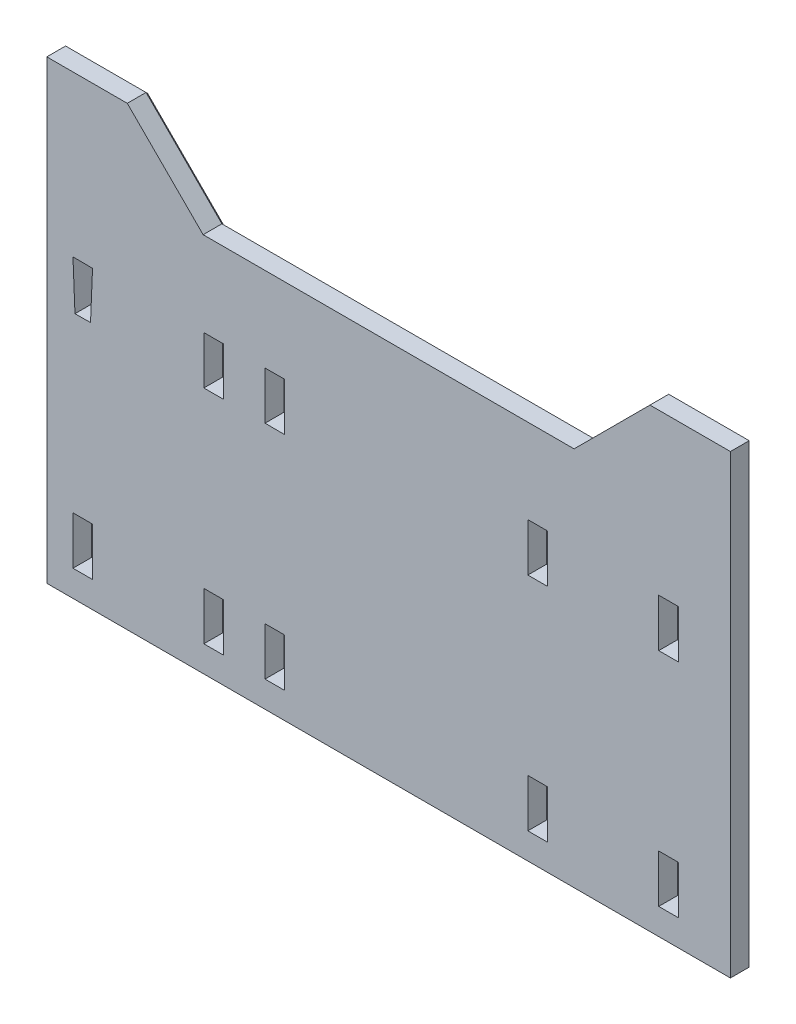
from build123d import *

# Parameters (mm, degrees)
SKETCH1_W           = 127.440194606
SKETCH1_H           = 60
SKETCH1_W_2         = 3.65
SKETCH1_H_2         = 8.949747706
BOSS_EXTRUDE1_DEPTH = 4
BOSS_EXTRUDE2_DEPTH = 4
CHAMFER1_SIZE       = 0.5


with BuildPart() as part:
    # Sketch1 → Boss-Extrude1 (new body)
    with BuildSketch(Plane.XY):
        Rectangle(SKETCH1_W, SKETCH1_H)
        with Locations((-32.620097303, 20.65)):
            Rectangle(SKETCH1_W_2, SKETCH1_H_2, mode=Mode.SUBTRACT)
        with Locations((27.7799027, 20.65)):
            Rectangle(SKETCH1_W_2, SKETCH1_H_2, mode=Mode.SUBTRACT)
        with Locations((27.7799027, -20.65)):
            Rectangle(SKETCH1_W_2, SKETCH1_H_2, mode=Mode.SUBTRACT)
        Polygon((-19.39514332, 25.124869244), (-23.045051285, 25.098949165), (-23.032206024, 16.201050835), (-19.407988581, 16.175130756), align=None, mode=Mode.SUBTRACT)
        with Locations((-21.220097303, -20.65)):
            Rectangle(SKETCH1_W_2, SKETCH1_H_2, mode=Mode.SUBTRACT)
        with Locations((52.1799027, 20.65)):
            Rectangle(SKETCH1_W_2, SKETCH1_H_2, mode=Mode.SUBTRACT)
        with Locations((52.1799027, -20.65)):
            Rectangle(SKETCH1_W_2, SKETCH1_H_2, mode=Mode.SUBTRACT)
        with Locations((-32.620097303, -20.65)):
            Rectangle(SKETCH1_W_2, SKETCH1_H_2, mode=Mode.SUBTRACT)
        Polygon((-58.845053986, 25.146117406), (-55.19514062, 25.120969439), (-55.568922769, 16.179030561), (-58.471271836, 16.153882594), align=None, mode=Mode.SUBTRACT)
        with Locations((-57.020097303, -20.65)):
            Rectangle(SKETCH1_W_2, SKETCH1_H_2, mode=Mode.SUBTRACT)
    extrude(amount=-BOSS_EXTRUDE1_DEPTH)

    # Sketch2 → Boss-Extrude2 (add)
    with BuildSketch(Plane.XY):
        Polygon((-63.720097303, 30), (-63.720097303, 55), (-48.720097303, 55), (-34.577961679, 40.857864376), (34.577961679, 40.857864376), (48.720097303, 55), (63.720097303, 55), (63.720097303, 30), align=None)
    extrude(amount=-BOSS_EXTRUDE2_DEPTH)

    # Chamfer1
    chamfer1_edges = [part.edges().sort_by_distance(p)[0] for p in [
        (56.220097303, 55, -4),
        (41.649029491, 47.928932188, -4),
        (0, 40.857864376, -4),
        (-41.649029491, 47.928932188, -4),
        (-56.220097303, 55, -4),
        (-63.720097303, 12.5, -4),
        (0, -30, -4),
        (63.720097303, 12.5, -4),
        (29.6049027, 20.65, -4),
        (27.7799027, 16.175126147, -4),
        (25.9549027, 20.65, -4),
        (27.7799027, 25.124873853, -4),
        (29.6049027, -20.65, -4),
        (27.7799027, -25.124873853, -4),
        (25.9549027, -20.65, -4),
        (27.7799027, -16.175126147, -4),
        (-23.038628654, 20.65, -4),
        (-21.220097303, 25.111909204, -4),
        (-19.401565951, 20.65, -4),
        (-21.220097303, 16.188090796, -4),
        (-23.045097303, -20.65, -4),
        (-21.220097303, -16.175126147, -4),
        (-19.395097303, -20.65, -4),
        (-21.220097303, -25.124873853, -4),
        (-30.795097303, 20.65, -4),
        (-32.620097303, 16.175126147, -4),
        (-34.445097303, 20.65, -4),
        (-32.620097303, 25.124873853, -4),
        (-30.795097303, -20.65, -4),
        (-32.620097303, -25.124873853, -4),
        (-34.445097303, -20.65, -4),
        (-32.620097303, -16.175126147, -4),
        (54.0049027, 20.65, -4),
        (52.1799027, 16.175126147, -4),
        (50.3549027, 20.65, -4),
        (52.1799027, 25.124873853, -4),
        (54.0049027, -20.65, -4),
        (52.1799027, -25.124873853, -4),
        (50.3549027, -20.65, -4),
        (52.1799027, -16.175126147, -4),
        (-55.382031694, 20.65, -4),
        (-57.020097303, 16.166456578, -4),
        (-58.658162911, 20.65, -4),
        (-57.020097303, 25.133543422, -4),
        (-55.195097303, -20.65, -4),
        (-57.020097303, -25.124873853, -4),
        (-58.845097303, -20.65, -4),
        (-57.020097303, -16.175126147, -4),
    ]]
    chamfer(chamfer1_edges, length=CHAMFER1_SIZE)


solid = part.part
